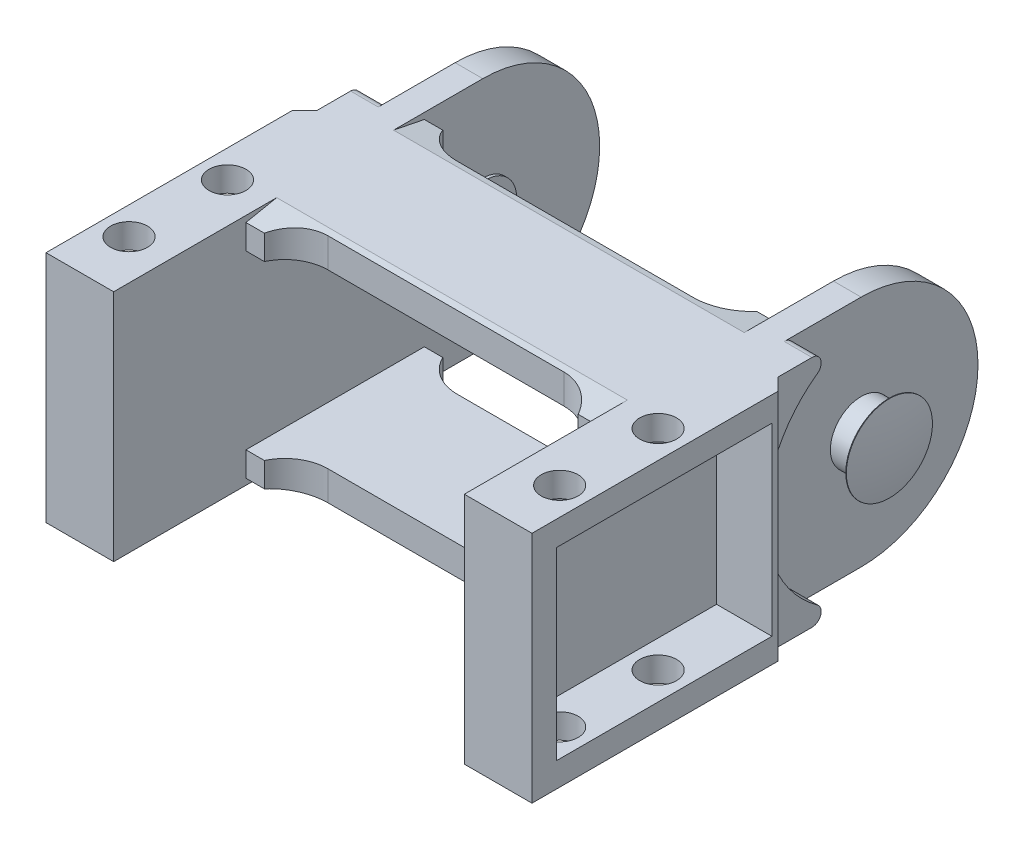
from build123d import *

# Parameters (mm, degrees)
BOSS_EXTRUDE1_START     = 28.5
BOSS_EXTRUDE1_DEPTH     = 9
CUT_EXTRUDE1_DEPTH      = 4.5
SKETCH3_R               = 5
CUT_EXTRUDE2_DEPTH      = 48.22552276
CIRPATTERN1_START       = 28.5
CIRPATTERN1_DEPTH       = 4.5
CIRPATTERN1_START_2     = 33
CIRPATTERN1_2_OUTLINE_R = 5
CIRPATTERN1_2_DEPTH     = 4.5
SKETCH4_W               = 29
SKETCH4_H               = 5
BOSS_EXTRUDE2_DEPTH     = 28.5
CUT_EXTRUDE3_DEPTH      = 61.135264197
SKETCH6_W               = 25.5
SKETCH6_H               = 4
CUT_EXTRUDE4_DEPTH      = 69.551075849
FILLET1_R               = 7
CUT_EXTRUDE5_DEPTH      = 69.946059827
BOSS_EXTRUDE3_DEPTH     = 38
SKETCH10_W              = 35
SKETCH10_H              = 30
CUT_EXTRUDE7_DEPTH      = 9
SKETCH11_R              = 3
CUT_EXTRUDE8_DEPTH      = 70.665271118
SKETCH14_R              = 5
BOSS_EXTRUDE4_DEPTH     = 4.5
CUT_EXTRUDE9_DEPTH      = 90.124092509
CUT_EXTRUDE9_DEPTH_BACK = 4.5
SKETCH12_R              = 5


# Read off the part's stored shape, not the designer's step: CirPattern1
with BuildPart() as part:
    # Sketch1 → Boss-Extrude1 (new body)
    with BuildSketch(Plane(origin=(0, 0, 0), x_dir=(0, 0, -1), z_dir=(1, 0, 0)).offset(BOSS_EXTRUDE1_START)):
        with BuildLine():
            Line((24, -19), (-24, -19))
            ThreePointArc((-24, -19), (-43, 0), (-24, 19))
            Line((-24, 19), (24, 19))
            ThreePointArc((24, 19), (43, 0), (24, -19))
        make_face()
    extrude(amount=BOSS_EXTRUDE1_DEPTH)

    # Sketch2 → Cut-Extrude1 (cut)
    with BuildSketch(Plane(origin=(37.5, 0, 0), x_dir=(0, 0, -1), z_dir=(1, 0, 0))):
        with BuildLine():
            Line((-11.510004003, -19), (24, -19))
            Line((24, -19), (24, -42.915105585))
            Line((24, -42.915105585), (-69.339300191, -42.915105585))
            Line((-69.339300191, -42.915105585), (-69.339300191, 41.365624017))
            Line((-69.339300191, 41.365624017), (24, 41.365624017))
            Line((24, 41.365624017), (24, 19))
            Line((24, 19), (-11.510004003, 19))
            ThreePointArc((-11.510004003, 19), (-12.938533903, 17.957495711), (-12.381399073, 16.279069767))
            ThreePointArc((-12.381399073, 16.279069767), (-4, 0), (-12.381399073, -16.279069767))
            ThreePointArc((-12.381399073, -16.279069767), (-12.938533903, -17.957495711), (-11.510004003, -19))
        make_face()
    extrude(amount=-CUT_EXTRUDE1_DEPTH, mode=Mode.SUBTRACT)

    # Sketch3 → Cut-Extrude2 (cut, through all)
    with BuildSketch(Plane(origin=(33, 0, 0), x_dir=(0, 0, -1), z_dir=(1, 0, 0))):
        with Locations((-24, 0)):
            Circle(SKETCH3_R)
    extrude(amount=-CUT_EXTRUDE2_DEPTH, mode=Mode.SUBTRACT)

    # CirPattern1 outline → CirPattern1 (cut)
    with BuildSketch(Plane.YZ.offset(CIRPATTERN1_START)):
        with BuildLine():
            ThreePointArc((16.279069767, -12.381399073), (0, -4), (-16.279069767, -12.381399073))
            ThreePointArc((-16.279069767, -12.381399073), (-17.957495711, -12.938533903), (-19, -11.510004003))
            Line((-19, -11.510004003), (-19, -24))
            ThreePointArc((-19, -24), (0, -43), (19, -24))
            Line((19, -24), (19, -11.510004003))
            ThreePointArc((19, -11.510004003), (17.957495711, -12.938533903), (16.279069767, -12.381399073))
        make_face()
    extrude(amount=CIRPATTERN1_DEPTH, mode=Mode.SUBTRACT)

    # CirPattern1 2 outline → CirPattern1 2 (cut)
    with BuildSketch(Plane.YZ.offset(CIRPATTERN1_START_2)):
        with Locations((0, -24)):
            Circle(CIRPATTERN1_2_OUTLINE_R)
    extrude(amount=CIRPATTERN1_2_DEPTH, mode=Mode.SUBTRACT)


with BuildPart() as body_2:
    # Sketch4 → Boss-Extrude2 (new body)
    with BuildSketch(Plane.ZY.offset(-28.5)):
        with Locations((0, 16.5)):
            Rectangle(SKETCH4_W, SKETCH4_H)
    extrude(amount=BOSS_EXTRUDE2_DEPTH)

    # Sketch5 → Cut-Extrude3 (cut, through all)
    with BuildSketch(Plane.ZY):
        Polygon((-9.5, 19), (-14.5, 19), (-14.5, 18), align=None)
        Polygon((14.5, 18), (9.5, 19), (14.5, 19), align=None)
    extrude(amount=-CUT_EXTRUDE3_DEPTH, mode=Mode.SUBTRACT)

    # Sketch6 → Cut-Extrude4 (cut, through all)
    with BuildSketch(Plane(origin=(0, 19, 0), x_dir=(1, 0, 0), z_dir=(0, 1, 0))):
        with Locations((12.75, 12.5)):
            Rectangle(SKETCH6_W, SKETCH6_H)
        with Locations((12.75, -12.5)):
            Rectangle(SKETCH6_W, SKETCH6_H)
    extrude(amount=-CUT_EXTRUDE4_DEPTH, mode=Mode.SUBTRACT)

    # Fillet1
    # the kernel refuses this fillet: 7 mm, written as the material it adds along each edge
    with BuildSketch(Plane(origin=(25.5, 34.611388301, -10.5), x_dir=(0, 0, -1), z_dir=(0, -1, 0))) as fillet1_piece_1_section:
        with BuildLine():
            CenterArc((7, -6.32455532), FILLET1_R, 115.376933525, 64.623066475)
            Line((0, -6.32455532), (-0.14, -6.32455532))
            Line((-0.14, -6.32455532), (-0.14, 0))
            Line((-0.14, 0), (0, 0.14))
            ThreePointArc((0, 0.14), (2, 0.14), (3.94, 0.126491106))
            Line((3.94, 0.126491106), (4, 0))
        make_face()
    fillet1_piece_1 = extrude(amount=20.611388301, mode=Mode.PRIVATE)
    fillet1_piece_1 = split(fillet1_piece_1, bisect_by=Plane(origin=(23.914802674, 18.512286415, -11.938567923), z_dir=(0, -0.9805806756909202, 0.1961161351381841)), keep=Keep.TOP, mode=Mode.PRIVATE)
    add(fillet1_piece_1)
    with BuildSketch(Plane(origin=(25.5, 34.611388301, 10.5), x_dir=(-1, 0, 0), z_dir=(0, -1, 0))) as fillet1_piece_2_section:
        with BuildLine():
            CenterArc((6.32455532, -7), FILLET1_R, 90, 64.623066475)
            Line((0, -4), (-0.126491106, -3.94))
            ThreePointArc((-0.126491106, -3.94), (-0.14, -2), (-0.14, 0))
            Line((-0.14, 0), (0, 0.14))
            Line((0, 0.14), (6.32455532, 0.14))
            Line((6.32455532, 0.14), (6.32455532, 0))
        make_face()
    fillet1_piece_2 = extrude(amount=20.611388301, mode=Mode.PRIVATE)
    fillet1_piece_2 = split(fillet1_piece_2, bisect_by=Plane(origin=(23.914802674, 18.512286415, 11.938567923), z_dir=(0, -0.9805806756909202, -0.1961161351381841)), keep=Keep.TOP, mode=Mode.PRIVATE)
    add(fillet1_piece_2)


with BuildPart() as body_3:
    # Mirror1: mirrored copy
    add(body_2.part.mirror(Plane.ZX))


with BuildPart() as body_2_1:
    add(body_2.part)

    # Combine1: union part, body 3
    add(part.part)
    add(body_3.part)

    # Mirror2: body 2 across plane


with BuildPart() as body_2_2:
    add(body_2_1.part)
    add(body_2_1.part.mirror(Plane(origin=(0, 0, 0), x_dir=(0, 0, 1), z_dir=(1, 0, 0))))

    # Sketch9 → Cut-Extrude5 (cut, through all)
    with BuildSketch(Plane(origin=(0, 19, 0), x_dir=(1, 0, 0), z_dir=(0, 1, 0))):
        Polygon((-50.684175345, 49.546643659), (0, 49.546643659), (0, -14.5), (47.40252606, -14.5), (47.40252606, -48.723397375), (0, -48.723397375), (-50.684175345, -48.723397375), align=None)
    extrude(amount=-CUT_EXTRUDE5_DEPTH, mode=Mode.SUBTRACT)

    # Sketch8 → Boss-Extrude3 (add)
    with BuildSketch(Plane(origin=(0, 19, 0), x_dir=(1, 0, 0), z_dir=(0, 1, 0))):
        Polygon((39.5, 4), (37.5, 6), (33.584622935, 6), (33.584622935, 3.307606204), (28.5, 3.307606204), (28.5, -36), (39.5, -36), align=None)
    extrude(amount=-BOSS_EXTRUDE3_DEPTH)

    # Sketch10 → Cut-Extrude7 (cut)
    with BuildSketch(Plane(origin=(39.5, 0, 0), x_dir=(0, 0, -1), z_dir=(1, 0, 0))):
        with Locations((-14.5, 0)):
            Rectangle(SKETCH10_W, SKETCH10_H)
    extrude(amount=-CUT_EXTRUDE7_DEPTH, mode=Mode.SUBTRACT)

    # Sketch11 → Cut-Extrude8 (cut, through all)
    with BuildSketch(Plane(origin=(0, 19, 0), x_dir=(1, 0, 0), z_dir=(0, 1, 0))):
        with Locations(Location((35, -27, 0), (0, 0, 270))):
            Circle(SKETCH11_R)
        with Locations(Location((35, -11, 0), (0, 0, 270))):
            Circle(SKETCH11_R)
    extrude(amount=-CUT_EXTRUDE8_DEPTH, mode=Mode.SUBTRACT)

    # Sketch14 → Boss-Extrude4 (add)
    with BuildSketch(Plane.ZY.offset(-33)):
        with BuildLine():
            Line((-24, -19), (-11.510004003, -19))
            ThreePointArc((-11.510004003, -19), (-12.938533903, -17.957495711), (-12.381399073, -16.279069767))
            ThreePointArc((-12.381399073, -16.279069767), (-4, 0), (-12.381399073, 16.279069767))
            ThreePointArc((-12.381399073, 16.279069767), (-12.938533903, 17.957495711), (-11.510004003, 19))
            Line((-11.510004003, 19), (-24, 19))
            ThreePointArc((-24, 19), (-43, 0), (-24, -19))
        make_face()
        with Locations(Location((-24, 0, 0), (0, 0, 180))):
            Circle(SKETCH14_R, mode=Mode.SUBTRACT)
    extrude(amount=BOSS_EXTRUDE4_DEPTH)

    # Sketch12 → Cut-Extrude9 (cut, two sides: drawn at the far end of the back side and taken through both)
    with BuildSketch(Plane(origin=(37.5, 0, 0), x_dir=(0, 0, -1), z_dir=(1, 0, 0)).offset(-CUT_EXTRUDE9_DEPTH_BACK)):
        with BuildLine():
            Line((11.510004003, -19), (24, -19))
            ThreePointArc((24, -19), (43, 0), (24, 19))
            Line((24, 19), (11.510004003, 19))
            ThreePointArc((11.510004003, 19), (12.938533903, 17.957495711), (12.381399073, 16.279069767))
            ThreePointArc((12.381399073, 16.279069767), (4, 0), (12.381399073, -16.279069767))
            ThreePointArc((12.381399073, -16.279069767), (12.938533903, -17.957495711), (11.510004003, -19))
        make_face()
        with Locations((24, 0)):
            Circle(SKETCH12_R, mode=Mode.SUBTRACT)
    extrude(amount=CUT_EXTRUDE9_DEPTH + CUT_EXTRUDE9_DEPTH_BACK, mode=Mode.SUBTRACT)

    # Mirror5: body 2 across plane


with BuildPart() as body_2_2_1:
    # Sketch7 → Revolve1 (revolve)
    with BuildSketch(Plane(origin=(0, 0, 0), x_dir=(1, 0, 0), z_dir=(0, 1, 0)), mode=Mode.PRIVATE) as revolve1_sk:
        with BuildLine():
            Line((37.6, 31), (37.5, 31))
            Line((37.5, 31), (37.5, 29))
            Line((37.5, 29), (28, 29))
            Line((28, 29), (28, 27.5))
            Line((28, 27.5), (37.5, 27.5))
            Line((37.5, 27.5), (37.5, 24))
            Line((37.5, 24), (38.217262665, 24))
            ThreePointArc((38.217262665, 24), (38.062648178, 27.513581264), (37.6, 31))
        make_face()
    revolve(revolve1_sk.sketch.rotate(Axis((37.5, 0, -24), (-1, 0, 0)), 180), axis=Axis((37.5, 0, -24), (-1, 0, 0)))


with BuildPart() as body_3_2:
    # Mirror4: mirrored copy
    add(body_2_2_1.part.mirror(Plane(origin=(0, 0, 0), x_dir=(0, 0, 1), z_dir=(1, 0, 0))))


with BuildPart() as body_2_3:
    add(body_2_2.part)
    add(body_2_2.part.mirror(Plane(origin=(0, -19, -49.546643659), x_dir=(0, 0, 1), z_dir=(1, 0, 0))))


solid = Compound([body_2_2_1.part, body_3_2.part, body_2_3.part])
